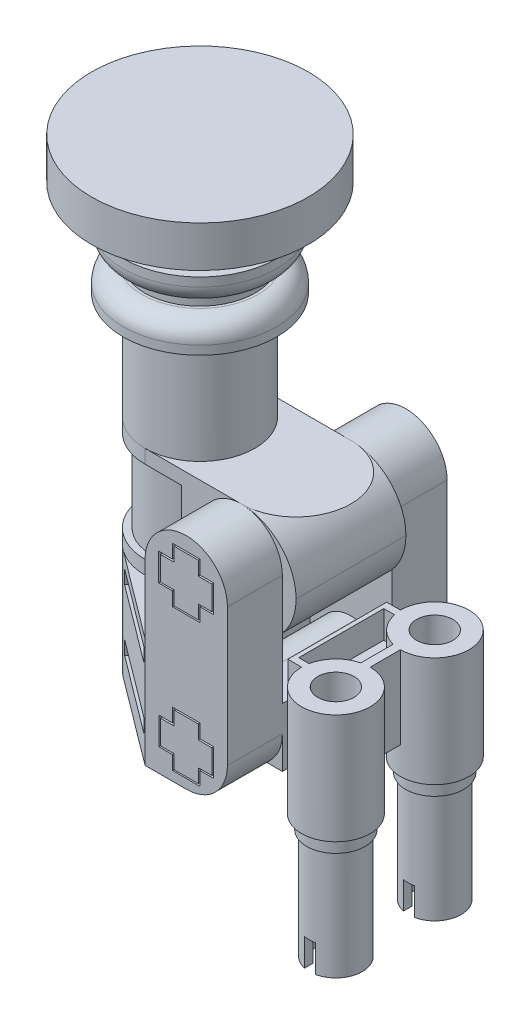
from build123d import *

# Parameters (mm, degrees)
BOSS_EXTRUDE1_DEPTH       = 0.0001
BOSS_EXTRUDE2_DEPTH       = 8
FILLET1_R                 = 4
FILLET2_R                 = 4
CUT_EXTRUDE1_START        = -1
SKETCH19_R                = 3.5
CUT_EXTRUDE1_DEPTH        = 6
BOSS_EXTRUDE3_DEPTH       = 8
BOSS_EXTRUDE4_DEPTH       = 4
BOSS_EXTRUDE11_DEPTH      = 4
BOSS_EXTRUDE12_DEPTH      = 4
BOSS_EXTRUDE13_DEPTH      = 4
CUT_EXTRUDE3_DEPTH        = 2
CUT_EXTRUDE6_DEPTH        = 2
BOSS_EXTRUDE14_REACH      = 24.825
SKETCH33_R                = 2.466914626
BOSS_EXTRUDE16_DEPTH      = 8
BOSS_EXTRUDE17_REACH      = 24.716
BOSS_EXTRUDE17_END_RADIUS = 2.466914626
SKETCH35_W                = 8
SKETCH35_H                = 4.287776708
SKETCH36_W                = 1
SKETCH36_H                = 7.2
BOSS_EXTRUDE18_DEPTH      = 6
SKETCH37_R                = 2.499896896
BOSS_EXTRUDE19_DEPTH      = 8
BOSS_EXTRUDE19_2_DEPTH    = 8
BOSS_EXTRUDE20_DEPTH      = 6
CUT_EXTRUDE7_DEPTH        = 2
SKETCH40_R                = 2.123023315
BOSS_EXTRUDE21_DEPTH      = 1
BOSS_EXTRUDE21_2_DEPTH    = 1
SKETCH41_R                = 1.923023315
SKETCH41_R_2              = 1.323023315
BOSS_EXTRUDE22_DEPTH      = 8
BOSS_EXTRUDE22_2_DEPTH    = 8
SKETCH42_R                = 1.323023315
SKETCH42_R_2              = 1.325
CUT_EXTRUDE9_DEPTH        = 18
CUT_EXTRUDE12_DEPTH       = 2
SKETCH47_W                = 6.974811551
SKETCH47_H                = 1
CUT_EXTRUDE15_DEPTH       = 1
SKETCH48_R                = 4
BOSS_EXTRUDE23_DEPTH      = 7.82
SKETCH49_R                = 5.59
BOSS_EXTRUDE24_DEPTH      = 2
FILLET3_R                 = 1.36
SKETCH50_R                = 4.035
BOSS_EXTRUDE25_DEPTH      = 0.94
SKETCH51_R                = 5.59
BOSS_EXTRUDE26_DEPTH      = 2
FILLET4_R                 = 1.36
SKETCH52_R                = 2.115
BOSS_EXTRUDE28_DEPTH      = 2.04
SKETCH53_R                = 7.895
BOSS_EXTRUDE29_DEPTH      = 3


with BuildPart() as part:
    # Sketch1 → Boss-Extrude1 (new body)
    with BuildSketch(Plane(origin=(0, 0, 0), x_dir=(1, 0, 0), z_dir=(0, 1, 0))):
        with BuildLine():
            Line((0, -4), (-7, -4))
            ThreePointArc((-7, -4), (-11, 0), (-7, 4))
            Line((-7, 4), (0, 4))
            ThreePointArc((0, 4), (4, 0), (0, -4))
        make_face()
    extrude(amount=BOSS_EXTRUDE1_DEPTH)

    # Sketch48 → Boss-Extrude23 (add)
    with BuildSketch(Plane(origin=(0, 0.0001, 0), x_dir=(1, 0, 0), z_dir=(0, 1, 0))):
        with Locations(Location((-7, 0, 0), (0, 0, 270))):
            Circle(SKETCH48_R)
    extrude(amount=BOSS_EXTRUDE23_DEPTH)

    # Sketch49 → Boss-Extrude24 (add)
    with BuildSketch(Plane(origin=(0, 7.8201, 0), x_dir=(1, 0, 0), z_dir=(0, 1, 0))):
        with Locations(Location((-7, 0, 0), (0, 0, 270))):
            Circle(SKETCH49_R)
    extrude(amount=BOSS_EXTRUDE24_DEPTH)

    # Fillet3
    fillet3_edges = [part.edges().sort_by_distance(p)[0] for p in [
        (-7, 9.8201, -5.59),
    ]]
    fillet(fillet3_edges, radius=FILLET3_R)

    # Sketch50 → Boss-Extrude25 (add)
    with BuildSketch(Plane(origin=(0, 9.8201, 0), x_dir=(1, 0, 0), z_dir=(0, 1, 0))):
        with Locations(Location((-7, 0, 0), (0, 0, 270))):
            Circle(SKETCH50_R)
    extrude(amount=BOSS_EXTRUDE25_DEPTH)

    # Sketch51 → Boss-Extrude26 (add)
    with BuildSketch(Plane(origin=(0, 10.7601, 0), x_dir=(1, 0, 0), z_dir=(0, 1, 0))):
        with Locations(Location((-7, 0, 0), (0, 0, 270))):
            Circle(SKETCH51_R)
    extrude(amount=BOSS_EXTRUDE26_DEPTH)

    # Fillet4
    fillet4_edges = [part.edges().sort_by_distance(p)[0] for p in [
        (-7, 10.7601, -5.59),
    ]]
    fillet(fillet4_edges, radius=FILLET4_R)

    # Sketch52 → Boss-Extrude28 (add)
    with BuildSketch(Plane(origin=(0, 12.7601, 0), x_dir=(1, 0, 0), z_dir=(0, 1, 0))):
        with Locations(Location((-7, 0, 0), (0, 0, 270))):
            Circle(SKETCH52_R)
    extrude(amount=BOSS_EXTRUDE28_DEPTH)

    # Sketch53 → Boss-Extrude29 (add)
    with BuildSketch(Plane(origin=(0, 14.8001, 0), x_dir=(1, 0, 0), z_dir=(0, 1, 0))):
        with Locations(Location((-7, 0, 0), (0, 0, 270))):
            Circle(SKETCH53_R)
    extrude(amount=BOSS_EXTRUDE29_DEPTH)


with BuildPart() as body_2:
    # Sketch18 → Boss-Extrude2 (new body)
    with BuildSketch(Plane.XZ):
        with BuildLine():
            Line((-7, 4), (4, 4))
            Line((4, 4), (4, -4))
            Line((4, -4), (-7, -4))
            ThreePointArc((-7, -4), (-11, 0), (-7, 4))
        make_face()
    extrude(amount=BOSS_EXTRUDE2_DEPTH)

    # Fillet1
    fillet1_edges = [body_2.edges().sort_by_distance(p)[0] for p in [
        (4, -8, 0),
    ]]
    fillet(fillet1_edges, radius=FILLET1_R)

    # Fillet2
    fillet2_edges = [body_2.edges().sort_by_distance(p)[0] for p in [
        (4, 0, 0),
    ]]
    fillet(fillet2_edges, radius=FILLET2_R - 0.0001)  # a hair under: the kernel refuses the full size

    # Sketch19 → Cut-Extrude1 (cut)
    with BuildSketch(Plane.XZ.offset(8).offset(CUT_EXTRUDE1_START)):
        with BuildLine():
            Line((-2.215843823, 0.380707864), (0, 0.380707864))
            Line((0, 0.380707864), (0, -0.661102551))
            Line((0, -0.661102551), (-2.246471603, -0.661102551))
            ThreePointArc((-2.246471603, -0.661102551), (-11.797207417, 0.141031239), (-2.215843823, 0.380707864))
        make_face()
        with Locations(Location((-7, 0, 0), (0, 0, 270))):
            Circle(SKETCH19_R, mode=Mode.SUBTRACT)
    extrude(amount=-CUT_EXTRUDE1_DEPTH, mode=Mode.SUBTRACT)


with BuildPart() as body_3:
    # Sketch20 → Boss-Extrude3 (new body)
    with BuildSketch(Plane.XZ.offset(8)):
        Polygon((-3, 8), (-9.4, 3.2), (-9.4, -3.2), (-3, -8), align=None)
    extrude(amount=BOSS_EXTRUDE3_DEPTH)



with BuildPart() as body_4:
    # Sketch22 → Boss-Extrude4 (new body)
    with BuildSketch(Plane(origin=(0, 0, -4), x_dir=(-1, 0, 0), z_dir=(0, 0, -1))):
        with BuildLine():
            Line((3, -3), (3, -13))
            ThreePointArc((3, -13), (0, -16), (-3, -13))
            Line((-3, -13), (-3, -3))
            ThreePointArc((-3, -3), (0, 0), (3, -3))
        make_face()
    extrude(amount=BOSS_EXTRUDE4_DEPTH)


with BuildPart() as body_5:
    # Sketch23 → Boss-Extrude11 (new body)
    with BuildSketch(Plane.XY.offset(4)):
        with BuildLine():
            Line((3, -3), (3, -13))
            ThreePointArc((3, -13), (0, -16), (-3, -13))
            Line((-3, -13), (-3, -3))
            ThreePointArc((-3, -3), (0, 0), (3, -3))
        make_face()
    extrude(amount=BOSS_EXTRUDE11_DEPTH)


with BuildPart() as body_3_1:
    add(body_3.part)

    add(body_5.part)  # Boss-Extrude12 merges body 5
    # Sketch25 → Boss-Extrude12 (add)
    with BuildSketch(Plane.XY.offset(8)):
        with BuildLine():
            Line((0, -16), (-3, -16))
            Line((-3, -16), (-3, -13))
            ThreePointArc((-3, -13), (-2.121320344, -15.121320344), (0, -16))
        make_face()
    extrude(amount=-BOSS_EXTRUDE12_DEPTH)


    add(body_4.part)  # Boss-Extrude13 merges body 4
    # Sketch26 → Boss-Extrude13 (add)
    with BuildSketch(Plane(origin=(0, 0, -8), x_dir=(-1, 0, 0), z_dir=(0, 0, -1))):
        with BuildLine():
            Line((3, -13), (3, -16))
            Line((3, -16), (0, -16))
            ThreePointArc((0, -16), (2.121320344, -15.121320344), (3, -13))
        make_face()
    extrude(amount=-BOSS_EXTRUDE13_DEPTH)

    # Sketch27 → Cut-Extrude3 (cut)
    # profile 1 of 2: a face of its own
    with BuildSketch(Plane(origin=(0, 0, -8), x_dir=(-1, 0, 0), z_dir=(0, 0, -1))):
        Polygon((-1, -1.5), (1, -1.5), (1, -2.5), (2, -2.5), (2, -4.5), (1, -4.5), (1, -5.5), (-1, -5.5), (-1, -4.5), (-2, -4.5), (-2, -2.5), (-1, -2.5), align=None)
        Polygon((-0.875, -2.63412041), (-1.875, -2.63412041), (-1.875, -4.38412041), (-0.875, -4.38412041), (-0.875, -5.393240821), (0.875, -5.393240821), (0.875, -4.38412041), (1.875, -4.38412041), (1.875, -2.63412041), (0.875, -2.63412041), (0.875, -1.625), (-0.875, -1.625), align=None, mode=Mode.SUBTRACT)
    # profile 2 of 2: a face of its own
    with BuildSketch(Plane(origin=(0, 0, -8), x_dir=(-1, 0, 0), z_dir=(0, 0, -1))):
        Polygon((-1, -11.36450224), (1, -11.36450224), (1, -12.36450224), (2, -12.36450224), (2, -14.36450224), (1, -14.36450224), (1, -15.36450224), (-1, -15.36450224), (-1, -14.36450224), (-2, -14.36450224), (-2, -12.36450224), (-1, -12.36450224), align=None)
        Polygon((-0.875, -12.49862265), (-1.875, -12.49862265), (-1.875, -14.24862265), (-0.875, -14.24862265), (-0.875, -15.25774306), (0.875, -15.25774306), (0.875, -14.24862265), (1.875, -14.24862265), (1.875, -12.49862265), (0.875, -12.49862265), (0.875, -11.48950224), (-0.875, -11.48950224), align=None, mode=Mode.SUBTRACT)
    extrude(amount=-CUT_EXTRUDE3_DEPTH, mode=Mode.SUBTRACT)

    # Sketch30 → Cut-Extrude6 (cut)
    # profile 1 of 2: a face of its own
    with BuildSketch(Plane.XY.offset(8)):
        Polygon((-1, -0.988576671), (1, -0.988576671), (1, -1.988576671), (1.997515412, -1.988576671), (1.997515412, -3.988576671), (1, -3.988576671), (1, -4.988576671), (-1, -4.988576671), (-1, -3.988576671), (-2.002484588, -3.988576671), (-2.002484588, -1.988576671), (-1, -1.988576671), align=None)
        Polygon((-0.875, -2.122698062), (-1.875, -2.122698062), (-1.875, -3.872698062), (-0.875, -3.872698062), (-0.875, -4.881817982), (0.875, -4.881817982), (0.875, -3.872698062), (1.875, -3.872698062), (1.875, -2.122698062), (0.875, -2.122698062), (0.875, -1.113578142), (-0.875, -1.113578142), align=None, mode=Mode.SUBTRACT)
    # profile 2 of 2: a face of its own
    with BuildSketch(Plane.XY.offset(8)):
        Polygon((-1, -11.320301788), (1, -11.320301788), (1, -12.320301788), (2, -12.320301788), (2, -14.320301788), (1, -14.320301788), (1, -15.320301788), (-1, -15.320301788), (-1, -14.320301788), (-2, -14.320301788), (-2, -12.320301788), (-1, -12.320301788), align=None)
        Polygon((-0.875, -12.454422198), (-1.875, -12.454422198), (-1.875, -14.204422198), (-0.875, -14.204422198), (-0.875, -15.213542609), (0.875, -15.213542609), (0.875, -14.204422198), (1.875, -14.204422198), (1.875, -12.454422198), (0.875, -12.454422198), (0.875, -11.445301788), (-0.875, -11.445301788), align=None, mode=Mode.SUBTRACT)
    extrude(amount=-CUT_EXTRUDE6_DEPTH, mode=Mode.SUBTRACT)


with BuildPart() as body_4_2:

    # Sketch33 → Boss-Extrude14 (new, up to next)
    with BuildSketch(Plane(origin=(0, 0, 4), x_dir=(-1, 0, 0), z_dir=(0, 0, -1)), mode=Mode.PRIVATE) as boss_extrude14_sk1:
        with Locations((0, -13.533085374)):
            Circle(SKETCH33_R)
    boss_extrude14_tool1 = extrude(boss_extrude14_sk1.sketch, amount=BOSS_EXTRUDE14_REACH, mode=Mode.PRIVATE) - body_3_1.part
    add(boss_extrude14_tool1.solids().sort_by_distance((0, -13.533085, 4))[0])


with BuildPart() as body_5_2:
    # Sketch34 → Boss-Extrude16 (new body)
    with BuildSketch(Plane.XZ.offset(8)):
        with BuildLine():
            Line((-9.4, 3.2), (-9.4, -3.2))
            ThreePointArc((-9.4, -3.2), (-11, 0), (-9.4, 3.2))
        make_face()
    extrude(amount=BOSS_EXTRUDE16_DEPTH)


with BuildPart() as body_6:
    # Boss-Extrude17: up to this cylinder (the profile starts outside it)
    boss_extrude17_end = Plane(origin=(0, -13.533085374, 0), z_dir=(0, 0, 1)) * Cylinder(BOSS_EXTRUDE17_END_RADIUS, 55.365829251, mode=Mode.PRIVATE)
    # Sketch35 → Boss-Extrude17 (new, up to the surface)
    with BuildSketch(Plane(origin=(3, 0, 0), x_dir=(0, 0, -1), z_dir=(1, 0, 0)), mode=Mode.PRIVATE) as boss_extrude17_sk1:
        with Locations((0, -13.238690847)):
            Rectangle(SKETCH35_W, SKETCH35_H)
    boss_extrude17_tool1 = extrude(boss_extrude17_sk1.sketch, amount=-BOSS_EXTRUDE17_REACH, mode=Mode.PRIVATE) - boss_extrude17_end
    add(boss_extrude17_tool1.solids().sort_by_distance((3, -13.238691, 0))[0])


with BuildPart() as body_3_2:
    add(body_3_1.part)

    add(body_6.part)  # Boss-Extrude18 merges body 6
    # Sketch36 → Boss-Extrude18 (add)
    with BuildSketch(Plane(origin=(0, -8.5, 0), x_dir=(1, 0, 0), z_dir=(0, 1, 0))):
        with Locations((3.5, 0)):
            Rectangle(SKETCH36_W, SKETCH36_H)
    extrude(amount=-BOSS_EXTRUDE18_DEPTH)



with BuildPart() as body_6_2:
    # Sketch37 → Boss-Extrude19 (new body)
    with BuildSketch(Plane(origin=(0, -8.5, 0), x_dir=(1, 0, 0), z_dir=(0, 1, 0))):
        with Locations(Location((6.499896896, 3.6, 0), (0, 0, 270))):
            Circle(SKETCH37_R)
    extrude(amount=-BOSS_EXTRUDE19_DEPTH)


with BuildPart() as body_7:
    # Sketch37 → Boss-Extrude19 2 (new body)
    with BuildSketch(Plane(origin=(0, -8.5, 0), x_dir=(1, 0, 0), z_dir=(0, 1, 0))):
        with Locations(Location((6.499896896, -3.6, 0), (0, 0, 270))):
            Circle(SKETCH37_R)
    extrude(amount=-BOSS_EXTRUDE19_2_DEPTH)


with BuildPart() as body_3_3:
    add(body_3_2.part)

    add(body_6_2.part)  # Boss-Extrude20 merges body 6 2

    add(body_7.part)  # Boss-Extrude20 merges body 7
    # Sketch38 → Boss-Extrude20 (add)
    with BuildSketch(Plane(origin=(0, -8.5, 0), x_dir=(1, 0, 0), z_dir=(0, 1, 0))):
        with BuildLine():
            Line((4, 3.6), (4, -3.6))
            ThreePointArc((4, -3.6), (4.732202849, -1.832305952), (6.499896896, -1.100103104))
            Line((6.499896896, -1.100103104), (6.499896896, 1.100103104))
            ThreePointArc((6.499896896, 1.100103104), (4.732202849, 1.832305952), (4, 3.6))
        make_face()
    extrude(amount=-BOSS_EXTRUDE20_DEPTH)

    # Sketch39 → Cut-Extrude7 (cut)
    with BuildSketch(Plane(origin=(0, -8.5, 0), x_dir=(1, 0, 0), z_dir=(0, 1, 0))):
        with BuildLine():
            Line((3.298541781, 3.089646857), (4.088383893, 3.089646857))
            ThreePointArc((4.088383893, 3.089646857), (4.717152516, 1.876879181), (5.889545476, 1.175701485))
            Line((5.889545476, 1.175701485), (5.889545476, -1.175756688))
            ThreePointArc((5.889545476, -1.175756688), (4.691210487, -1.874271758), (4.049687206, -3.104059515))
            Line((4.049687206, -3.104059515), (3.298541781, -3.104059515))
            Line((3.298541781, -3.104059515), (3.298541781, 3.089646857))
        make_face()
    extrude(amount=-CUT_EXTRUDE7_DEPTH, mode=Mode.SUBTRACT)


with BuildPart() as body_6_3:
    # Sketch40 → Boss-Extrude21 (new body)
    with BuildSketch(Plane.XZ.offset(16.5)):
        with Locations(Location((6.499896896, 3.6, 0), (0, 0, 270))):
            Circle(SKETCH40_R)
    extrude(amount=BOSS_EXTRUDE21_DEPTH)


with BuildPart() as body_7_2:
    # Sketch40 → Boss-Extrude21 2 (new body)
    with BuildSketch(Plane.XZ.offset(16.5)):
        with Locations(Location((6.499896896, -3.6, 0), (0, 0, 270))):
            Circle(SKETCH40_R)
    extrude(amount=BOSS_EXTRUDE21_2_DEPTH)


with BuildPart() as body_8:
    # Sketch41 → Boss-Extrude22 (new body)
    with BuildSketch(Plane.XZ.offset(17.5)):
        with Locations(Location((6.499896896, 3.6, 0), (0, 0, 270))):
            Circle(SKETCH41_R)
        with Locations(Location((6.499896896, 3.6, 0), (0, 0, 270))):
            Circle(SKETCH41_R_2, mode=Mode.SUBTRACT)
    extrude(amount=BOSS_EXTRUDE22_DEPTH)


with BuildPart() as body_9:
    # Sketch41 → Boss-Extrude22 2 (new body)
    with BuildSketch(Plane.XZ.offset(17.5)):
        with Locations(Location((6.499896896, -3.6, 0), (0, 0, 270))):
            Circle(SKETCH41_R)
        with Locations(Location((6.499896896, -3.6, 0), (0, 0, 270))):
            Circle(SKETCH41_R_2, mode=Mode.SUBTRACT)
    extrude(amount=BOSS_EXTRUDE22_2_DEPTH)


with BuildPart() as cut_extrude9_tool:
    # Sketch42 → Cut-Extrude9 (new body)
    with BuildSketch(Plane.XZ.offset(25.5)):
        with Locations(Location((6.499896896, 3.6, 0), (0, 0, 270))):
            Circle(SKETCH42_R)
        with Locations(Location((6.499896896, -3.6, 0), (0, 0, 270))):
            Circle(SKETCH42_R_2)
    extrude(amount=-CUT_EXTRUDE9_DEPTH)


with BuildPart() as body_3_4:
    add(body_3_3.part)

    # Cut-Extrude9: cut by cut_extrude9_tool
    add(cut_extrude9_tool.part, mode=Mode.SUBTRACT)

    # Sketch47 → Cut-Extrude15 (cut)
    with BuildSketch(Plane(origin=(-4.92, 0, -6.56), x_dir=(-0.8000000000000003, 0, 0.5999999999999998), z_dir=(-0.5999999999999998, 0, -0.8000000000000004))):
        with Locations((1.544464356, -9.307185428)):
            Rectangle(SKETCH47_W, SKETCH47_H)
        with Locations((1.544464356, -13.772958012)):
            Rectangle(SKETCH47_W, SKETCH47_H)
    cut_extrude15 = extrude(amount=-CUT_EXTRUDE15_DEPTH, mode=Mode.SUBTRACT)

    # Mirror2: Cut-Extrude15 across plane
    add(cut_extrude15.mirror(Plane.XY), mode=Mode.SUBTRACT)


with BuildPart() as body_6_3_1:
    add(body_6_3.part)

    # Cut-Extrude9: cut by cut_extrude9_tool
    add(cut_extrude9_tool.part, mode=Mode.SUBTRACT)


with BuildPart() as body_7_2_1:
    add(body_7_2.part)

    # Cut-Extrude9: cut by cut_extrude9_tool
    add(cut_extrude9_tool.part, mode=Mode.SUBTRACT)


with BuildPart() as body_9_1:
    add(body_9.part)

    # Cut-Extrude9: cut by cut_extrude9_tool
    add(cut_extrude9_tool.part, mode=Mode.SUBTRACT)


with BuildPart() as cut_extrude12_tool:
    # Sketch44 → Cut-Extrude12 (new body)
    with BuildSketch(Plane.XZ.offset(25.5)):
        with BuildLine():
            Line((6.099896896, 5.600786234), (6.099896896, 1.600786234))
            ThreePointArc((6.099896896, 1.600786234), (6.499896896, 1.559039814), (6.899896896, 1.600786234))
            Line((6.899896896, 1.600786234), (6.899896896, 5.599213766))
            ThreePointArc((6.899896896, 5.599213766), (6.499978953, 5.641746502), (6.099896896, 5.600786234))
        make_face()
        with BuildLine():
            Line((6.099896896, -1.599213766), (6.099896896, -5.599213766))
            ThreePointArc((6.099896896, -5.599213766), (6.499896896, -5.640960186), (6.899896896, -5.599213766))
            Line((6.899896896, -5.599213766), (6.899896896, -1.600786234))
            ThreePointArc((6.899896896, -1.600786234), (6.499978953, -1.558253498), (6.099896896, -1.599213766))
        make_face()
    extrude(amount=-CUT_EXTRUDE12_DEPTH)


with BuildPart() as body_8_1:
    add(body_8.part)

    # Cut-Extrude12: cut by cut_extrude12_tool
    add(cut_extrude12_tool.part, mode=Mode.SUBTRACT)


with BuildPart() as body_9_2:
    add(body_9_1.part)

    # Cut-Extrude12: cut by cut_extrude12_tool
    add(cut_extrude12_tool.part, mode=Mode.SUBTRACT)


solid = Compound([part.part, body_2.part, body_4_2.part, body_5_2.part, body_3_4.part, body_6_3_1.part, body_7_2_1.part, body_8_1.part, body_9_2.part])
